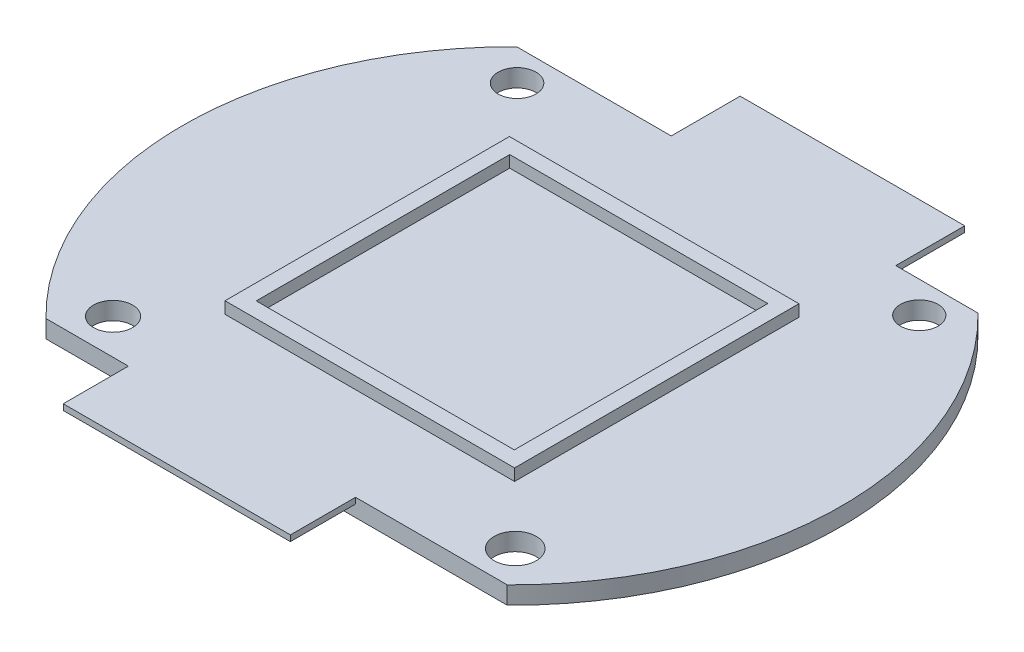
from build123d import *

# Parameters (mm, degrees)
SKETCH2_R           = 1.610129379
SKETCH2_R_2         = 1.66029091
SKETCH2_R_3         = 1.791193395
SKETCH2_R_4         = 1.600916599
BOSS_EXTRUDE1_DEPTH = 1.5
SKETCH3_W           = 19.081191899
SKETCH3_H           = 5.85855086
SKETCH3_W_2         = 19.299887508
SKETCH3_H_2         = 5.534917291
BOSS_EXTRUDE2_DEPTH = 0.5
SKETCH4_W           = 24.601924878
SKETCH4_H           = 24.16573396
SKETCH4_W_2         = 21.926940144
SKETCH4_H_2         = 21.538176574
BOSS_EXTRUDE3_DEPTH = 1


with BuildPart() as part:
    # Sketch2 → Boss-Extrude1 (new body)
    with BuildSketch(Plane(origin=(0, 0, 0), x_dir=(1, 0, 0), z_dir=(0, 1, 0))):
        with BuildLine():
            Line((8.404082058, 20), (47.595917942, 20))
            ThreePointArc((47.595917942, 20), (56, 0), (47.595917942, -20))
            Line((47.595917942, -20), (8.404082058, -20))
            ThreePointArc((8.404082058, -20), (0, 0), (8.404082058, 20))
        make_face()
        with Locations((11.087651709, 17.343003221)):
            Circle(SKETCH2_R, mode=Mode.SUBTRACT)
        with Locations((11.087651709, -16.98750612)):
            Circle(SKETCH2_R_2, mode=Mode.SUBTRACT)
        with Locations((45.262584723, -16.98750612)):
            Circle(SKETCH2_R_3, mode=Mode.SUBTRACT)
        with Locations((45.262584723, 17.343003221)):
            Circle(SKETCH2_R_4, mode=Mode.SUBTRACT)
    extrude(amount=BOSS_EXTRUDE1_DEPTH)

    # Sketch3 → Boss-Extrude2 (add)
    with BuildSketch(Plane(origin=(0, 1.5, 0), x_dir=(1, 0, 0), z_dir=(0, 1, 0))):
        with Locations((31.069199174, 22.92927543)):
            Rectangle(SKETCH3_W, SKETCH3_H)
        with Locations((25.055069922, -22.767458645)):
            Rectangle(SKETCH3_W_2, SKETCH3_H_2)
    extrude(amount=-BOSS_EXTRUDE2_DEPTH)

    # Sketch4 → Boss-Extrude3 (add)
    with BuildSketch(Plane(origin=(0, 1.5, 0), x_dir=(1, 0, 0), z_dir=(0, 1, 0))):
        with Locations((28, 0)):
            Rectangle(SKETCH4_W, SKETCH4_H)
        with Locations((28, 0)):
            Rectangle(SKETCH4_W_2, SKETCH4_H_2, mode=Mode.SUBTRACT)
    extrude(amount=BOSS_EXTRUDE3_DEPTH)


solid = part.part
